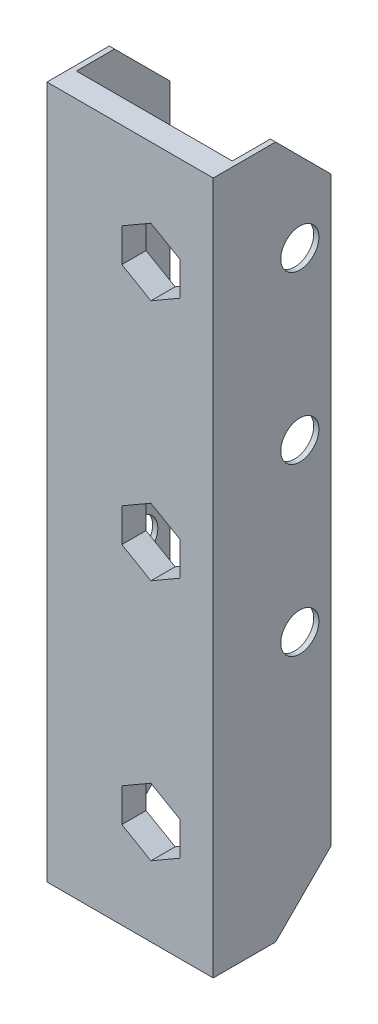
from build123d import *

# Parameters (mm, degrees)
BOSS_EXTRUDE1_DEPTH     = 100
CUT_EXTRUDE1_DEPTH      = 105.235310716
CUT_EXTRUDE1_DEPTH_BACK = 105.235310716
M5_CLEARANCE_HOLE1_D    = 5.5
CHAMFER1_SIZE           = 8


with BuildPart() as part:
    # Sketch1 → Boss-Extrude1 (new body)
    with BuildSketch(Plane(origin=(0, 0, 0), x_dir=(1, 0, 0), z_dir=(0, 1, 0))):
        Polygon((0, 0), (0, 17), (0.75, 17), (0.75, 3.5), (23.25, 3.5), (23.25, 17), (24, 17), (24, 0), align=None)
    extrude(amount=BOSS_EXTRUDE1_DEPTH)

    # Sketch2 → Cut-Extrude1 (cut, two sides: drawn at the far end of the back side and taken through both)
    with BuildSketch(Plane.XY.offset(-CUT_EXTRUDE1_DEPTH_BACK)):
        Polygon((10.8, 82.575128869), (15, 80.150257739), (19.2, 82.575128869), (19.2, 87.424871131), (15, 89.849742261), (10.8, 87.424871131), align=None)
        Polygon((10.8, 47.575128869), (15, 45.150257739), (19.2, 47.575128869), (19.2, 52.424871131), (15, 54.849742261), (10.8, 52.424871131), align=None)
        Polygon((19.2, 17.424871131), (15, 19.849742261), (10.8, 17.424871131), (10.8, 12.575128869), (15, 10.150257739), (19.2, 12.575128869), align=None)
    extrude(amount=CUT_EXTRUDE1_DEPTH + CUT_EXTRUDE1_DEPTH_BACK, mode=Mode.SUBTRACT)

    # M5 Clearance Hole1 (through all)
    with Locations(Plane(origin=(24, 0, 0), x_dir=(0, 0, -1), z_dir=(1, 0, 0))):
        with Locations((12.5, 85), (12.5, 37), (12.5, 61)):
            Hole(M5_CLEARANCE_HOLE1_D / 2)

    # Chamfer1
    chamfer1_edges = [part.edges().sort_by_distance(p)[0] for p in [
        (0.375, 100, -17),
        (23.625, 100, -17),
        (23.625, 0, -17),
        (0.375, 0, -17),
    ]]
    chamfer(chamfer1_edges, length=CHAMFER1_SIZE)


solid = part.part
